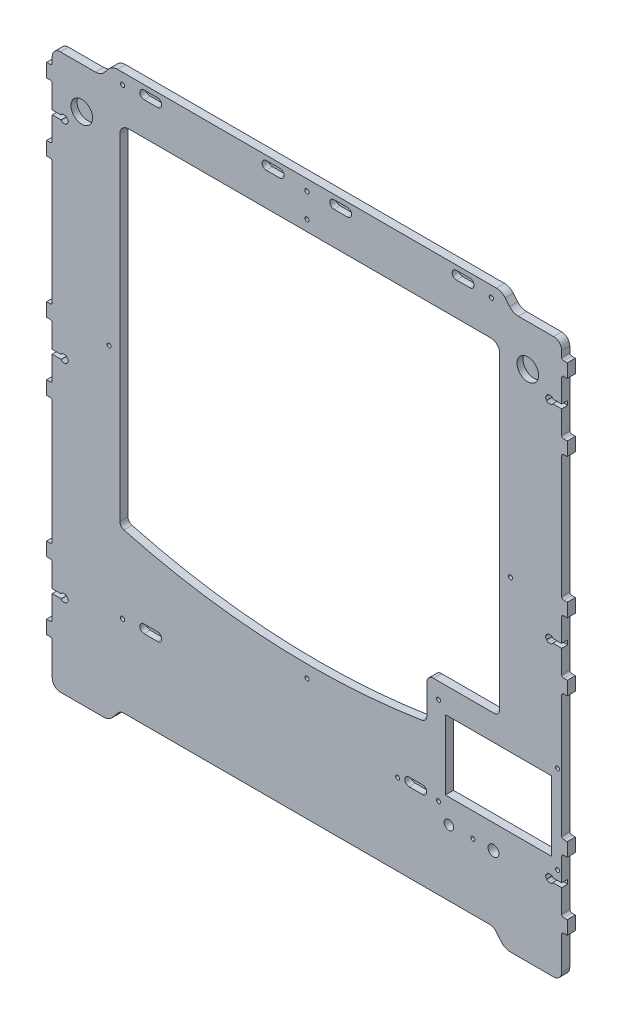
from build123d import *

# Parameters (mm, degrees)
CROQUIS1_R              = 1.6
SALIENTE_EXTRUIR1_DEPTH = 6
CROQUIS10_R             = 8
CROQUIS10_R_2           = 1.5
CROQUIS10_W             = 78.5
CROQUIS10_H             = 51.5
CORTAR_EXTRUIR4_DEPTH   = 4.5
CROQUIS12_R             = 1.5
CROQUIS12_R_2           = 3.5
CROQUIS12_R_3           = 4
CROQUIS12_W             = 78.5
CROQUIS12_H             = 51.5
CORTAR_EXTRUIR5_DEPTH   = 6
CROQUIS13_W             = 12.488895434
CROQUIS13_H             = 7.172211158
SALIENTE_EXTRUIR2_DEPTH = 6
CROQUIS14_R             = 1.5
CORTAR_EXTRUIR6_DEPTH   = 6
CROQUIS15_R             = 1.5
CORTAR_EXTRUIR7_DEPTH   = 6


with BuildPart() as part:
    # Croquis1 → Saliente-Extruir1 (new body)
    with BuildSketch(Plane.XY):
        with BuildLine():
            ThreePointArc((-224.50465507, 207.31041627), (-223.408639559, 206.856431781), (-222.95465507, 205.76041627))
            Line((-222.95465507, 205.76041627), (-222.95465507, 168.86041627))
            ThreePointArc((-222.95465507, 168.86041627), (-223.408639559, 167.764400759), (-224.50465507, 167.31041627))
            Line((-224.50465507, 167.31041627), (-227.10465507, 167.31041627))
            Line((-227.10465507, 167.31041627), (-227.10465507, 157.31041627))
            Line((-227.10465507, 157.31041627), (-224.504652909, 157.31041627))
            ThreePointArc((-224.504652909, 157.31041627), (-223.408638795, 156.856431017), (-222.95465507, 155.76041627))
            Line((-222.95465507, 155.76041627), (-222.95465507, 65.56041627))
            ThreePointArc((-222.95465507, 65.56041627), (-223.408638795, 64.464401523), (-224.504652909, 64.01041627))
            Line((-224.504652909, 64.01041627), (-227.10465507, 64.01041627))
            Line((-227.10465507, 64.01041627), (-227.10465507, 54.01041627))
            Line((-227.10465507, 54.01041627), (-224.50465507, 54.01041627))
            ThreePointArc((-224.50465507, 54.01041627), (-223.408639559, 53.556431781), (-222.95465507, 52.46041627))
            Line((-222.95465507, 52.46041627), (-222.95465507, 15.56041627))
            ThreePointArc((-222.95465507, 15.56041627), (-223.408639559, 14.464400759), (-224.50465507, 14.01041627))
            Line((-224.50465507, 14.01041627), (-227.10465507, 14.01041627))
            Line((-227.10465507, 14.01041627), (-227.10465507, 4.01041627))
            Line((-227.10465507, 4.01041627), (-224.50465507, 4.01041627))
            ThreePointArc((-224.50465507, 4.01041627), (-223.408639559, 3.556431781), (-222.95465507, 2.46041627))
            Line((-222.95465507, 2.46041627), (-222.95465507, -87.73958373))
            ThreePointArc((-222.95465507, -87.73958373), (-223.408638795, -88.835598477), (-224.504652909, -89.28958373))
            Line((-224.504652909, -89.28958373), (-227.10465507, -89.28958373))
            Line((-227.10465507, -89.28958373), (-227.10465507, -99.28958373))
            Line((-227.10465507, -99.28958373), (-224.50465507, -99.28958373))
            ThreePointArc((-224.50465507, -99.28958373), (-223.408639559, -99.743568219), (-222.95465507, -100.83958373))
            Line((-222.95465507, -100.83958373), (-222.95465507, -137.73958373))
            ThreePointArc((-222.95465507, -137.73958373), (-223.408639559, -138.835599241), (-224.50465507, -139.28958373))
            Line((-224.50465507, -139.28958373), (-227.10465507, -139.28958373))
            Line((-227.10465507, -139.28958373), (-227.10465507, -149.28958373))
            Line((-227.10465507, -149.28958373), (-224.50465507, -149.28958373))
            ThreePointArc((-224.50465507, -149.28958373), (-223.408639559, -149.743568219), (-222.95465507, -150.83958373))
            Line((-222.95465507, -150.83958373), (-222.95465507, -174.98958373))
            ThreePointArc((-222.95465507, -174.98958373), (-221.197295757, -179.232224417), (-216.95465507, -180.98958373))
            Line((-216.95465507, -180.98958373), (-184.95465507, -180.98958373))
            ThreePointArc((-184.95465507, -180.98958373), (-181.362399845, -180.19319992), (-178.443277303, -177.953278412))
            Line((-178.443277303, -177.953278412), (-174.251121407, -172.957261563))
            ThreePointArc((-174.251121407, -172.957261563), (-172.359383879, -171.505680303), (-170.031422678, -170.98958373))
            Line((-170.031422678, -170.98958373), (100.822112538, -170.98958373))
            ThreePointArc((100.822112538, -170.98958373), (103.15007374, -171.505680303), (105.041811268, -172.957261563))
            Line((105.041811268, -172.957261563), (109.233967164, -177.953278412))
            ThreePointArc((109.233967164, -177.953278412), (112.153089706, -180.19319992), (115.74534493, -180.98958373))
            Line((115.74534493, -180.98958373), (147.74534493, -180.98958373))
            ThreePointArc((147.74534493, -180.98958373), (151.987985617, -179.232224417), (153.74534493, -174.98958373))
            Line((153.74534493, -174.98958373), (153.74534493, -150.83958373))
            ThreePointArc((153.74534493, -150.83958373), (154.19932942, -149.743568219), (155.29534493, -149.28958373))
            Line((155.29534493, -149.28958373), (157.89534493, -149.28958373))
            Line((157.89534493, -149.28958373), (157.89534493, -139.28958373))
            Line((157.89534493, -139.28958373), (155.29534493, -139.28958373))
            ThreePointArc((155.29534493, -139.28958373), (154.19932942, -138.835599241), (153.74534493, -137.73958373))
            Line((153.74534493, -137.73958373), (153.74534493, -100.83958373))
            ThreePointArc((153.74534493, -100.83958373), (154.19932942, -99.743568219), (155.29534493, -99.28958373))
            Line((155.29534493, -99.28958373), (157.89534493, -99.28958373))
            Line((157.89534493, -99.28958373), (157.89534493, -89.28958373))
            Line((157.89534493, -89.28958373), (155.29534493, -89.28958373))
            ThreePointArc((155.29534493, -89.28958373), (154.19932942, -88.835599241), (153.74534493, -87.73958373))
            Line((153.74534493, -87.73958373), (153.74534493, 2.46041627))
            ThreePointArc((153.74534493, 2.46041627), (154.19932942, 3.556431781), (155.29534493, 4.01041627))
            Line((155.29534493, 4.01041627), (157.89534493, 4.01041627))
            Line((157.89534493, 4.01041627), (157.89534493, 14.01041627))
            Line((157.89534493, 14.01041627), (155.29534493, 14.01041627))
            ThreePointArc((155.29534493, 14.01041627), (154.19932942, 14.464400759), (153.74534493, 15.56041627))
            Line((153.74534493, 15.56041627), (153.74534493, 52.46041627))
            ThreePointArc((153.74534493, 52.46041627), (154.19932942, 53.556431781), (155.29534493, 54.01041627))
            Line((155.29534493, 54.01041627), (157.89534493, 54.01041627))
            Line((157.89534493, 54.01041627), (157.89534493, 64.01041627))
            Line((157.89534493, 64.01041627), (155.295342769, 64.01041627))
            ThreePointArc((155.295342769, 64.01041627), (154.199328655, 64.464401523), (153.74534493, 65.56041627))
            Line((153.74534493, 65.56041627), (153.74534493, 155.76041627))
            ThreePointArc((153.74534493, 155.76041627), (154.199328655, 156.856431017), (155.295342769, 157.31041627))
            Line((155.295342769, 157.31041627), (157.89534493, 157.31041627))
            Line((157.89534493, 157.31041627), (157.89534493, 167.31041627))
            Line((157.89534493, 167.31041627), (155.29534493, 167.31041627))
            ThreePointArc((155.29534493, 167.31041627), (154.19932942, 167.764400759), (153.74534493, 168.86041627))
            Line((153.74534493, 168.86041627), (153.74534493, 205.76041627))
            ThreePointArc((153.74534493, 205.76041627), (154.19932942, 206.856431781), (155.29534493, 207.31041627))
            Line((155.29534493, 207.31041627), (157.89534493, 207.31041627))
            Line((157.89534493, 207.31041627), (157.89534493, 217.31041627))
            Line((157.89534493, 217.31041627), (155.29534493, 217.31041627))
            ThreePointArc((155.29534493, 217.31041627), (154.19932942, 217.764400759), (153.74534493, 218.86041627))
            Line((153.74534493, 218.86041627), (153.74534493, 223.11041627))
            ThreePointArc((153.74534493, 223.11041627), (151.987985617, 227.353056957), (147.74534493, 229.11041627))
            Line((147.74534493, 229.11041627), (121.74534493, 229.11041627))
            ThreePointArc((121.74534493, 229.11041627), (118.153089706, 229.90680008), (115.233967164, 232.146721588))
            Line((115.233967164, 232.146721588), (112.02240616, 235.974110952))
            ThreePointArc((112.02240616, 235.974110952), (109.103283618, 238.21403246), (105.511028393, 239.01041627))
            Line((105.511028393, 239.01041627), (-174.720338532, 239.01041627))
            ThreePointArc((-174.720338532, 239.01041627), (-178.312593757, 238.21403246), (-181.231716299, 235.974110952))
            Line((-181.231716299, 235.974110952), (-184.443277303, 232.146721588))
            ThreePointArc((-184.443277303, 232.146721588), (-187.362399845, 229.90680008), (-190.95465507, 229.11041627))
            Line((-190.95465507, 229.11041627), (-216.95465507, 229.11041627))
            ThreePointArc((-216.95465507, 229.11041627), (-221.197295757, 227.353056957), (-222.95465507, 223.11041627))
            Line((-222.95465507, 223.11041627), (-222.95465507, 218.86041627))
            ThreePointArc((-222.95465507, 218.86041627), (-223.408639559, 217.764400759), (-224.50465507, 217.31041627))
            Line((-224.50465507, 217.31041627), (-227.10465507, 217.31041627))
            Line((-227.10465507, 217.31041627), (-227.10465507, 207.31041627))
            Line((-227.10465507, 207.31041627), (-224.50465507, 207.31041627))
        make_face()
        with Locations((-170.95465507, -110.98958373)):
            Circle(CROQUIS1_R, mode=Mode.SUBTRACT)
        with Locations((-170.95465507, 231.01041627)):
            Circle(CROQUIS1_R, mode=Mode.SUBTRACT)
        with Locations((-34.60465507, 231.01041627)):
            Circle(CROQUIS1_R, mode=Mode.SUBTRACT)
        with BuildLine():
            Line((-166.45465507, 205.01041627), (101.39534493, 205.01041627))
            ThreePointArc((101.39534493, 205.01041627), (105.991539008, 203.106610348), (107.89534493, 198.51041627))
            Line((107.89534493, 198.51041627), (107.89534493, -30.122789524))
            ThreePointArc((107.89534493, -30.122789524), (106.718164887, -32.964753549), (103.876200862, -34.141933592))
            Line((103.876200862, -34.141933592), (58.980791013, -34.141933592))
            ThreePointArc((58.980791013, -34.141933592), (55.49789864, -35.584594849), (54.055237383, -39.067487222))
            Line((54.055237383, -39.067487222), (54.055237383, -60.8574488))
            ThreePointArc((54.055237383, -60.8574488), (52.982386963, -63.764437894), (50.278275073, -65.277505143))
            ThreePointArc((50.278275073, -65.277505143), (-60.467212832, -71.021336983), (-169.9851138, -53.603413365))
            ThreePointArc((-169.9851138, -53.603413365), (-172.129247219, -52.128238814), (-172.95465507, -49.660010713))
            Line((-172.95465507, -49.660010713), (-172.95465507, 198.51041627))
            ThreePointArc((-172.95465507, 198.51041627), (-171.050849147, 203.106610348), (-166.45465507, 205.01041627))
        make_face(mode=Mode.SUBTRACT)
        with Locations((101.74534493, 231.01041627)):
            Circle(CROQUIS1_R, mode=Mode.SUBTRACT)
    extrude(amount=SALIENTE_EXTRUIR1_DEPTH)

    # Croquis10 → Cortar-Extruir4 (cut)
    with BuildSketch(Plane.XY.offset(6)):
        with Locations((128.74534493, 198.61041627)):
            Circle(CROQUIS10_R)
        with Locations((-201.10465507, 198.61041627)):
            Circle(CROQUIS10_R)
        with Locations((150.74534493, -110.98958373)):
            Circle(CROQUIS10_R_2)
        with Locations((150.74534493, -45.98958373)):
            Circle(CROQUIS10_R_2)
        with Locations((62.74534493, -45.98958373)):
            Circle(CROQUIS10_R_2)
        with Locations((62.74534493, -110.98958373)):
            Circle(CROQUIS10_R_2)
        with BuildLine():
            Line((-216.454429827, 188.86041627), (-222.95465507, 188.86041627))
            Line((-222.95465507, 188.86041627), (-222.95465507, 185.76041627))
            Line((-222.95465507, 185.76041627), (-216.454429827, 185.76041627))
            ThreePointArc((-216.454429827, 185.76041627), (-215.908828016, 184.89695016), (-214.94446294, 184.56041627))
            Line((-214.94446294, 184.56041627), (-213.39446294, 184.56041627))
            ThreePointArc((-213.39446294, 184.56041627), (-212.424527577, 184.901397911), (-211.881340797, 185.77431899))
            Line((-211.881340797, 185.77431899), (-211.881340797, 185.943563923))
            ThreePointArc((-211.881340797, 185.943563923), (-211.062022675, 187.31041627), (-211.881340797, 188.677268617))
            Line((-211.881340797, 188.677268617), (-211.881340797, 188.84651355))
            ThreePointArc((-211.881340797, 188.84651355), (-212.424527577, 189.719434629), (-213.39446294, 190.06041627))
            Line((-213.39446294, 190.06041627), (-214.94446294, 190.06041627))
            ThreePointArc((-214.94446294, 190.06041627), (-215.908828016, 189.72388238), (-216.454429827, 188.86041627))
        make_face()
        with BuildLine():
            Line((-216.454429827, 35.56041627), (-222.95465507, 35.56041627))
            Line((-222.95465507, 35.56041627), (-222.95465507, 32.46041627))
            Line((-222.95465507, 32.46041627), (-216.454429827, 32.46041627))
            ThreePointArc((-216.454429827, 32.46041627), (-215.908828016, 31.59695016), (-214.94446294, 31.26041627))
            Line((-214.94446294, 31.26041627), (-213.39446294, 31.26041627))
            ThreePointArc((-213.39446294, 31.26041627), (-212.424527577, 31.601397911), (-211.881340797, 32.47431899))
            Line((-211.881340797, 32.47431899), (-211.881340797, 32.643563923))
            ThreePointArc((-211.881340797, 32.643563923), (-211.062022675, 34.01041627), (-211.881340797, 35.377268617))
            Line((-211.881340797, 35.377268617), (-211.881340797, 35.54651355))
            ThreePointArc((-211.881340797, 35.54651355), (-212.424527577, 36.419434629), (-213.39446294, 36.76041627))
            Line((-213.39446294, 36.76041627), (-214.94446294, 36.76041627))
            ThreePointArc((-214.94446294, 36.76041627), (-215.908828016, 36.42388238), (-216.454429827, 35.56041627))
        make_face()
        with BuildLine():
            Line((-216.454429827, -117.73958373), (-222.95465507, -117.73958373))
            Line((-222.95465507, -117.73958373), (-222.95465507, -120.83958373))
            Line((-222.95465507, -120.83958373), (-216.454429827, -120.83958373))
            ThreePointArc((-216.454429827, -120.83958373), (-215.908828016, -121.70304984), (-214.94446294, -122.03958373))
            Line((-214.94446294, -122.03958373), (-213.39446294, -122.03958373))
            ThreePointArc((-213.39446294, -122.03958373), (-212.424527577, -121.698602089), (-211.881340797, -120.82568101))
            Line((-211.881340797, -120.82568101), (-211.881340797, -120.656436077))
            ThreePointArc((-211.881340797, -120.656436077), (-211.062022675, -119.28958373), (-211.881340797, -117.922731383))
            Line((-211.881340797, -117.922731383), (-211.881340797, -117.75348645))
            ThreePointArc((-211.881340797, -117.75348645), (-212.424527577, -116.880565371), (-213.39446294, -116.53958373))
            Line((-213.39446294, -116.53958373), (-214.94446294, -116.53958373))
            ThreePointArc((-214.94446294, -116.53958373), (-215.908828016, -116.87611762), (-216.454429827, -117.73958373))
        make_face()
        with BuildLine():
            Line((147.245119688, -120.83958373), (153.74534493, -120.83958373))
            Line((153.74534493, -120.83958373), (153.74534493, -117.73958373))
            Line((153.74534493, -117.73958373), (147.245119688, -117.73958373))
            ThreePointArc((147.245119688, -117.73958373), (146.699517877, -116.87611762), (145.735152801, -116.53958373))
            Line((145.735152801, -116.53958373), (144.185152801, -116.53958373))
            ThreePointArc((144.185152801, -116.53958373), (143.215217438, -116.880565371), (142.672030658, -117.75348645))
            Line((142.672030658, -117.75348645), (142.672030658, -117.922731383))
            ThreePointArc((142.672030658, -117.922731383), (141.852712535, -119.28958373), (142.672030658, -120.656436077))
            Line((142.672030658, -120.656436077), (142.672030658, -120.82568101))
            ThreePointArc((142.672030658, -120.82568101), (143.215217438, -121.698602089), (144.185152801, -122.03958373))
            Line((144.185152801, -122.03958373), (145.735152801, -122.03958373))
            ThreePointArc((145.735152801, -122.03958373), (146.699517877, -121.70304984), (147.245119688, -120.83958373))
        make_face()
        with BuildLine():
            Line((147.245119688, 32.46041627), (153.74534493, 32.46041627))
            Line((153.74534493, 32.46041627), (153.74534493, 35.56041627))
            Line((153.74534493, 35.56041627), (147.245119688, 35.56041627))
            ThreePointArc((147.245119688, 35.56041627), (146.699517877, 36.42388238), (145.735152801, 36.76041627))
            Line((145.735152801, 36.76041627), (144.185152801, 36.76041627))
            ThreePointArc((144.185152801, 36.76041627), (143.215217438, 36.419434629), (142.672030658, 35.54651355))
            Line((142.672030658, 35.54651355), (142.672030658, 35.377268617))
            ThreePointArc((142.672030658, 35.377268617), (141.852712535, 34.01041627), (142.672030658, 32.643563923))
            Line((142.672030658, 32.643563923), (142.672030658, 32.47431899))
            ThreePointArc((142.672030658, 32.47431899), (143.215217438, 31.601397911), (144.185152801, 31.26041627))
            Line((144.185152801, 31.26041627), (145.735152801, 31.26041627))
            ThreePointArc((145.735152801, 31.26041627), (146.699517877, 31.59695016), (147.245119688, 32.46041627))
        make_face()
        with BuildLine():
            Line((147.245119688, 185.76041627), (153.74534493, 185.76041627))
            Line((153.74534493, 185.76041627), (153.74534493, 188.86041627))
            Line((153.74534493, 188.86041627), (147.245119688, 188.86041627))
            ThreePointArc((147.245119688, 188.86041627), (146.699517877, 189.72388238), (145.735152801, 190.06041627))
            Line((145.735152801, 190.06041627), (144.185152801, 190.06041627))
            ThreePointArc((144.185152801, 190.06041627), (143.215217438, 189.719434629), (142.672030658, 188.84651355))
            Line((142.672030658, 188.84651355), (142.672030658, 188.677268617))
            ThreePointArc((142.672030658, 188.677268617), (141.852712535, 187.31041627), (142.672030658, 185.943563923))
            Line((142.672030658, 185.943563923), (142.672030658, 185.77431899))
            ThreePointArc((142.672030658, 185.77431899), (143.215217438, 184.901397911), (144.185152801, 184.56041627))
            Line((144.185152801, 184.56041627), (145.735152801, 184.56041627))
            ThreePointArc((145.735152801, 184.56041627), (146.699517877, 184.89695016), (147.245119688, 185.76041627))
        make_face()
        with BuildLine():
            Line((-64.60465507, 235.61041627), (-54.60465507, 235.61041627))
            ThreePointArc((-54.60465507, 235.61041627), (-51.50465507, 232.51041627), (-54.60465507, 229.41041627))
            Line((-54.60465507, 229.41041627), (-64.60465507, 229.41041627))
            ThreePointArc((-64.60465507, 229.41041627), (-67.70465507, 232.51041627), (-64.60465507, 235.61041627))
        make_face()
        with BuildLine():
            Line((-155.10465507, 235.61041627), (-145.10465507, 235.61041627))
            ThreePointArc((-145.10465507, 235.61041627), (-142.00465507, 232.51041627), (-145.10465507, 229.41041627))
            Line((-145.10465507, 229.41041627), (-155.10465507, 229.41041627))
            ThreePointArc((-155.10465507, 229.41041627), (-158.20465507, 232.51041627), (-155.10465507, 235.61041627))
        make_face()
        with BuildLine():
            Line((-4.60465507, 229.41041627), (-14.60465507, 229.41041627))
            ThreePointArc((-14.60465507, 229.41041627), (-17.70465507, 232.51041627), (-14.60465507, 235.61041627))
            Line((-14.60465507, 235.61041627), (-4.60465507, 235.61041627))
            ThreePointArc((-4.60465507, 235.61041627), (-1.50465507, 232.51041627), (-4.60465507, 229.41041627))
        make_face()
        with BuildLine():
            Line((85.89534493, 235.61041627), (75.89534493, 235.61041627))
            ThreePointArc((75.89534493, 235.61041627), (72.79534493, 232.51041627), (75.89534493, 229.41041627))
            Line((75.89534493, 229.41041627), (85.89534493, 229.41041627))
            ThreePointArc((85.89534493, 229.41041627), (88.99534493, 232.51041627), (85.89534493, 235.61041627))
        make_face()
        with BuildLine():
            Line((-155.10465507, -106.38958373), (-145.10465507, -106.38958373))
            ThreePointArc((-145.10465507, -106.38958373), (-142.00465507, -109.48958373), (-145.10465507, -112.58958373))
            Line((-145.10465507, -112.58958373), (-155.10465507, -112.58958373))
            ThreePointArc((-155.10465507, -112.58958373), (-158.20465507, -109.48958373), (-155.10465507, -106.38958373))
        make_face()
        with Locations((106.99534493, -78.73958373)):
            Rectangle(CROQUIS10_W, CROQUIS10_H)
        with BuildLine():
            Line((50.89534493, -106.38958373), (40.89534493, -106.38958373))
            ThreePointArc((40.89534493, -106.38958373), (37.79534493, -109.48958373), (40.89534493, -112.58958373))
            Line((40.89534493, -112.58958373), (50.89534493, -112.58958373))
            ThreePointArc((50.89534493, -112.58958373), (53.99534493, -109.48958373), (50.89534493, -106.38958373))
        make_face()
    extrude(amount=-CORTAR_EXTRUIR4_DEPTH, mode=Mode.SUBTRACT)

    # Croquis12 → Cortar-Extruir5 (cut)
    with BuildSketch(Plane.XY.offset(6)):
        with Locations((150.74534493, -110.98958373)):
            Circle(CROQUIS12_R)
        with Locations((150.74534493, -45.98958373)):
            Circle(CROQUIS12_R)
        with Locations((62.74534493, -45.98958373)):
            Circle(CROQUIS12_R)
        with Locations((62.74534493, -110.98958373)):
            Circle(CROQUIS12_R)
        with Locations((70.34534493, -122.33958373)):
            Circle(CROQUIS12_R_2)
        with Locations((88.09534493, -122.33958373)):
            Circle(CROQUIS12_R)
        with Locations((103.34534493, -122.33958373)):
            Circle(CROQUIS12_R_3)
        with Locations((106.99534493, -78.73958373)):
            Rectangle(CROQUIS12_W, CROQUIS12_H)
    extrude(amount=-CORTAR_EXTRUIR5_DEPTH, mode=Mode.SUBTRACT)

    # Croquis13 → Saliente-Extruir2 (add)
    with BuildSketch(Plane.XY.offset(6)):
        with Locations((102.714741828, -111.153279876)):
            Rectangle(CROQUIS13_W, CROQUIS13_H)
    extrude(amount=-SALIENTE_EXTRUIR2_DEPTH)

    # Croquis14 → Cortar-Extruir6 (cut)
    with BuildSketch(Plane.XY.offset(6)):
        with Locations((62.74534493, -110.98958373)):
            Circle(CROQUIS14_R)
        with Locations((32.38631374, -110.98958373)):
            Circle(CROQUIS14_R)
    extrude(amount=-CORTAR_EXTRUIR6_DEPTH, mode=Mode.SUBTRACT)

    # Croquis15 → Cortar-Extruir7 (cut)
    with BuildSketch(Plane(origin=(0, 0, 0), x_dir=(-1, 0, 0), z_dir=(0, 0, -1))):
        with Locations((34.60465507, 213.01041627)):
            Circle(CROQUIS15_R)
        with Locations((-115.89534493, 59.01041627)):
            Circle(CROQUIS15_R)
        with Locations((180.95465507, 59.01041627)):
            Circle(CROQUIS15_R)
        with Locations((34.60465507, -80.98958373)):
            Circle(CROQUIS15_R)
    extrude(amount=-CORTAR_EXTRUIR7_DEPTH, mode=Mode.SUBTRACT)


solid = part.part
